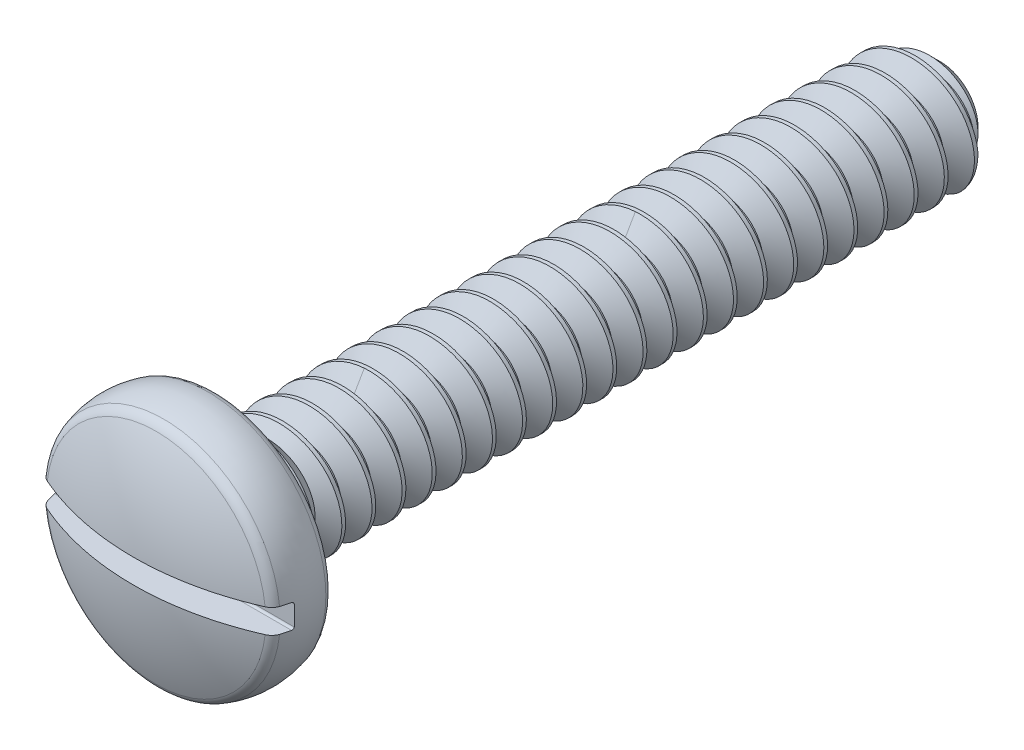
from build123d import *

# Parameters (mm, degrees)
CUT_EXTRUDE1_DEPTH      = 4.636275622
CUT_EXTRUDE1_DEPTH_BACK = 4.636275622
SKETCH9_W               = 0.35
SKETCH9_H               = 0.2
FILLET1_R               = 0.0175
FILLET2_R               = 0.105
CHAMFER1_SIZE           = 0.099
SPLIT1_START            = -3.35
SPLIT1_OUTLINE_R        = 0.5
SPLIT1_DEPTH            = 5.7
CUT_SWEEP1_PITCH        = 0.25
LPATTERN1_COUNT         = 3
LPATTERN1_PITCH         = 2.25


# Read off the part's stored shape, not the designer's step: Split1
with BuildPart() as part:
    # Sketch2 → Revolve1 (revolve)
    with BuildSketch(Plane(origin=(0, 0, 0), x_dir=(0, 0, -1), z_dir=(1, 0, 0)), mode=Mode.PRIVATE) as revolve1_sk:
        with BuildLine():
            Line((-2.65, 0.95), (-2.65, 0.51))
            Line((-2.65, 0.51), (-2.35, 0.51))
            Line((-2.35, 0.51), (-2.35, 0.5))
            Line((-2.35, 0.5), (3.1625, 0.5))
            Line((3.1625, 0.5), (3.35, 0.3125))
            Line((3.35, 0.3125), (3.35, 0))
            Line((3.35, 0), (-3.35, 0))
            ThreePointArc((-3.35, 0), (-3.296873863, 0.486466854), (-3.14, 0.95))
            ThreePointArc((-3.14, 0.95), (-2.895, 1), (-2.65, 0.95))
        make_face()
    revolve(revolve1_sk.sketch.rotate(Axis((0, 0, 3.35), (0, 0, -1)), 90), axis=Axis((0, 0, 3.35), (0, 0, -1)))

    # Sketch9 → Cut-Extrude1 (cut, two sides: drawn at the far end of the back side and taken through both)
    with BuildSketch(Plane(origin=(0, 0, 0), x_dir=(0, 0, -1), z_dir=(1, 0, 0)).offset(-CUT_EXTRUDE1_DEPTH_BACK)):
        with Locations((-3.175, 0)):
            Rectangle(SKETCH9_W, SKETCH9_H)
    extrude(amount=CUT_EXTRUDE1_DEPTH + CUT_EXTRUDE1_DEPTH_BACK, mode=Mode.SUBTRACT)

    # Fillet1
    fillet1_edges = [part.edges().sort_by_distance(p)[0] for p in [
        (0, 0.1, 3),
        (0, -0.1, 3),
    ]]
    fillet(fillet1_edges, radius=FILLET1_R)

    # Fillet2
    fillet2_edges = [part.edges().sort_by_distance(p)[0] for p in [
        (-0.95, 0, 2.65),
        (0, -0.95, 3.14),
        (0, 0.95, 3.14),
    ]]
    fillet(fillet2_edges, radius=FILLET2_R)

    # Chamfer1
    chamfer1_edges = [part.edges().sort_by_distance(p)[0] for p in [
        (-0.51, 0, 2.65),
    ]]
    chamfer(chamfer1_edges, length=CHAMFER1_SIZE)

    # Split1 outline → Split1 (cut)
    with BuildSketch(Plane.XY.offset(SPLIT1_START)):
        Circle(SPLIT1_OUTLINE_R)
    extrude(amount=SPLIT1_DEPTH, mode=Mode.SUBTRACT)



with BuildPart() as body_2:
    # Split1 2 outline → Split1 2 (revolve)
    with BuildSketch(Plane.XZ):
        Polygon((0.5, 2.35), (0, 2.35), (0, -3.35), (0.3125, -3.35), (0.5, -3.1625), align=None)
    revolve(axis=Axis((0, 0, 0), (0, 0, 1)))

    # Cut-Sweep1: the profile of Sketch7 profile screwed along a right-hand helix of 11 turns, 6 arcs to a turn; built about Z, then put on its axis
    cut_sweep1_z = Axis((0, 0, 0), (0, 0, 1))
    cut_sweep1_corners = [(0.5003, 0, 0.000173205), (0.5003, 0, -0.218923205), (0.337620237, 0, -0.125), (0.337620237, 0, -0.09375)]
    with BuildLine(mode=Mode.PRIVATE) as cut_sweep1_profile:
        Line(cut_sweep1_corners[0], cut_sweep1_corners[1])
        Line(cut_sweep1_corners[1], cut_sweep1_corners[2])
        Line(cut_sweep1_corners[2], cut_sweep1_corners[3])
        Line(cut_sweep1_corners[3], cut_sweep1_corners[0])
    cut_sweep1_cap = Face(cut_sweep1_profile.wire())
    cut_sweep1_turn_angles = [0, 30, 60, 90, 120, 150, 180, 210, 240, 270, 300, 330, 360]
    cut_sweep1_turn_weights = [1, 0.8660254037844387, 1, 0.8660254037844387, 1, 0.8660254037844387, 1, 0.8660254037844387, 1, 0.8660254037844387, 1, 0.8660254037844387, 1]
    cut_sweep1_turn_rails = [Edge.make_bspline([Vector(p[0], p[1], 0).rotate(cut_sweep1_z, cut_sweep1_turn_angles[k]) / cut_sweep1_turn_weights[k] + Vector(0, 0, p[2] + CUT_SWEEP1_PITCH * cut_sweep1_turn_angles[k] / 360) for k in range(13)], [0, 0, 0, 1, 1, 2, 2, 3, 3, 4, 4, 5, 5, 6, 6, 6], 2, cut_sweep1_turn_weights) for p in cut_sweep1_corners]
    cut_sweep1_turn_sides = [Face.make_surface_from_curves(cut_sweep1_turn_rails[p[0]], cut_sweep1_turn_rails[p[1]]) for p in [(0, 1), (1, 2), (2, 3), (3, 0)]]
    cut_sweep1 = Plane(origin=(0, 0, -3.35), x_dir=(0, 1, 0), z_dir=(0, 0, 1)) * Solid(Shell([*[p.moved(Location((0, 0, CUT_SWEEP1_PITCH * i))) for i in range(11) for p in cut_sweep1_turn_sides], cut_sweep1_cap, cut_sweep1_cap.rotate(cut_sweep1_z, 3960).moved(Location((0, 0, CUT_SWEEP1_PITCH * 3960 / 360)))]))
    add(cut_sweep1, mode=Mode.SUBTRACT)

    # LPattern1: Cut-Sweep1 ×3
    with Locations(*[(0, 0, i * LPATTERN1_PITCH) for i in range(1, LPATTERN1_COUNT)]):
        add(cut_sweep1, mode=Mode.SUBTRACT)


with BuildPart() as part_1:
    add(part.part)

    add(body_2.part)  # Boss-Extrude1 merges body 2
    # Boss-Extrude1 cone 1 section (through the dimple's axis) → Boss-Extrude1 (revolve)
    with BuildSketch(Plane(origin=(0, 0, 2.35), x_dir=(0, -1, 0), z_dir=(1, 0, 0))):
        Polygon((0, 0), (0.51, 0), (0, 0.51), align=None)
    revolve(axis=Axis((0, 0, 2.35), (0, 0, -1)))


solid = part_1.part
